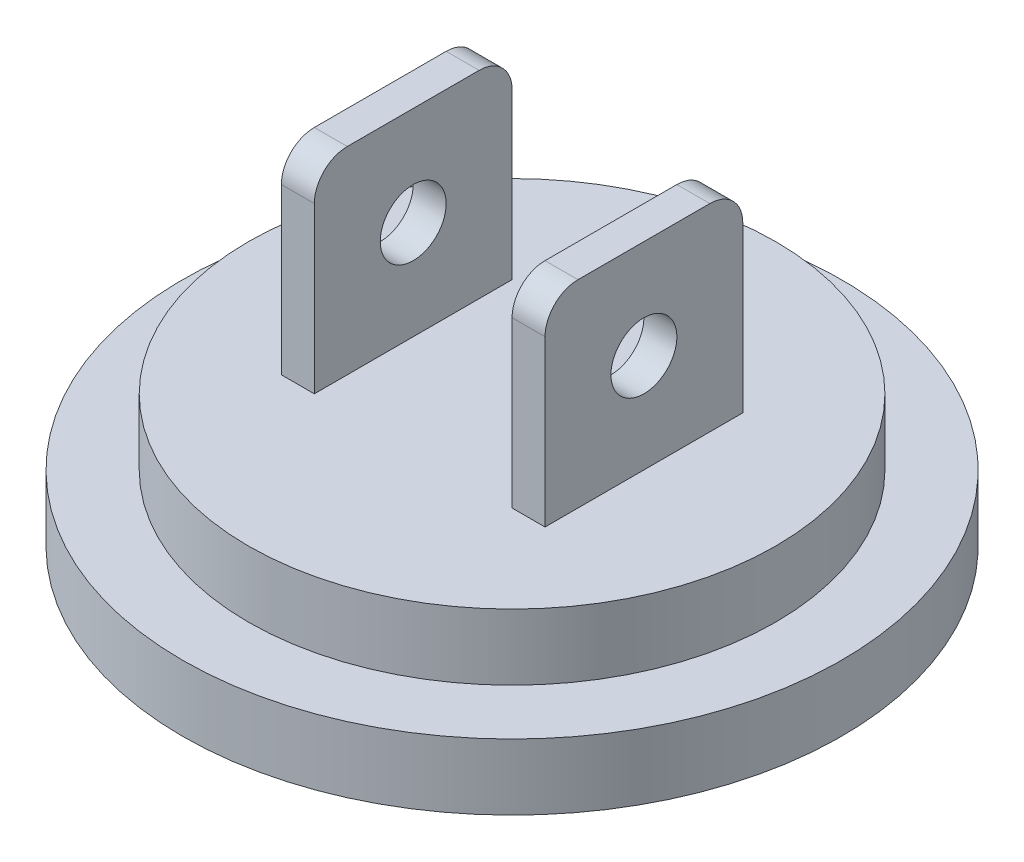
from build123d import *

# Parameters (mm, degrees)
SKETCH2_R           = 63.5
BOSS_EXTRUDE1_DEPTH = 12.7
SKETCH3_R           = 50.8
BOSS_EXTRUDE2_DEPTH = 12.7
SKETCH4_R           = 6.35
BOSS_EXTRUDE3_DEPTH = 25.4
SKETCH5_W           = 6.35
SKETCH5_H           = 38.1
BOSS_EXTRUDE4_DEPTH = 38.1
FILLET1_R           = 6.35
SKETCH6_R           = 6.35
CUT_EXTRUDE1_DEPTH  = 127.363404513
CUT_EXTRUDE2_START  = -12.7
CUT_EXTRUDE2_DEPTH  = 12.7
CIRPATTERN1_COUNT   = 28


with BuildPart() as part:
    # Sketch2 → Boss-Extrude1 (new body)
    with BuildSketch(Plane(origin=(0, 0, 0), x_dir=(1, 0, 0), z_dir=(0, 1, 0))):
        Circle(SKETCH2_R)
    extrude(amount=BOSS_EXTRUDE1_DEPTH)

    # Sketch3 → Boss-Extrude2 (add)
    with BuildSketch(Plane(origin=(0, 12.7, 0), x_dir=(1, 0, 0), z_dir=(0, 1, 0))):
        Circle(SKETCH3_R)
    extrude(amount=BOSS_EXTRUDE2_DEPTH)

    # Sketch4 → Boss-Extrude3 (add)
    with BuildSketch(Plane.XZ):
        Circle(SKETCH4_R)
    extrude(amount=BOSS_EXTRUDE3_DEPTH)

    # Sketch5 → Boss-Extrude4 (add)
    with BuildSketch(Plane(origin=(0, 25.4, 0), x_dir=(1, 0, 0), z_dir=(0, 1, 0))):
        with Locations((22.225, 0)):
            Rectangle(SKETCH5_W, SKETCH5_H)
        with Locations((-22.225, 0)):
            Rectangle(SKETCH5_W, SKETCH5_H)
    extrude(amount=BOSS_EXTRUDE4_DEPTH)

    # Fillet1
    fillet1_edges = [part.edges().sort_by_distance(p)[0] for p in [
        (22.225, 63.5, 19.05),
        (-22.225, 63.5, 19.05),
        (22.225, 63.5, -19.05),
        (-22.225, 63.5, -19.05),
    ]]
    fillet(fillet1_edges, radius=FILLET1_R)

    # Sketch6 → Cut-Extrude1 (cut, through all)
    with BuildSketch(Plane.ZY.offset(25.4)):
        with Locations((0, 44.45)):
            Circle(SKETCH6_R)
    extrude(amount=-CUT_EXTRUDE1_DEPTH, mode=Mode.SUBTRACT)

    # Sketch7 → Cut-Extrude2 (cut)
    with BuildSketch(Plane.XZ.offset(25.4).offset(CUT_EXTRUDE2_START)):
        with BuildLine():
            Line((0, 5.08), (0.710231041, 6.310156248))
            ThreePointArc((0.710231041, 6.310156248), (0, 6.35), (-0.710231041, 6.310156248))
            Line((-0.710231041, 6.310156248), (0, 5.08))
        make_face()
    cut_extrude2 = extrude(amount=CUT_EXTRUDE2_DEPTH, mode=Mode.SUBTRACT)

    # CirPattern1: Cut-Extrude2 ×28 about axis
    cirpattern1_axis = Axis((0, -25.4, 0), (0, 1, 0))
    for i in range(1, CIRPATTERN1_COUNT):
        add(cut_extrude2.rotate(cirpattern1_axis, i * 360 / CIRPATTERN1_COUNT), mode=Mode.SUBTRACT)


solid = part.part
